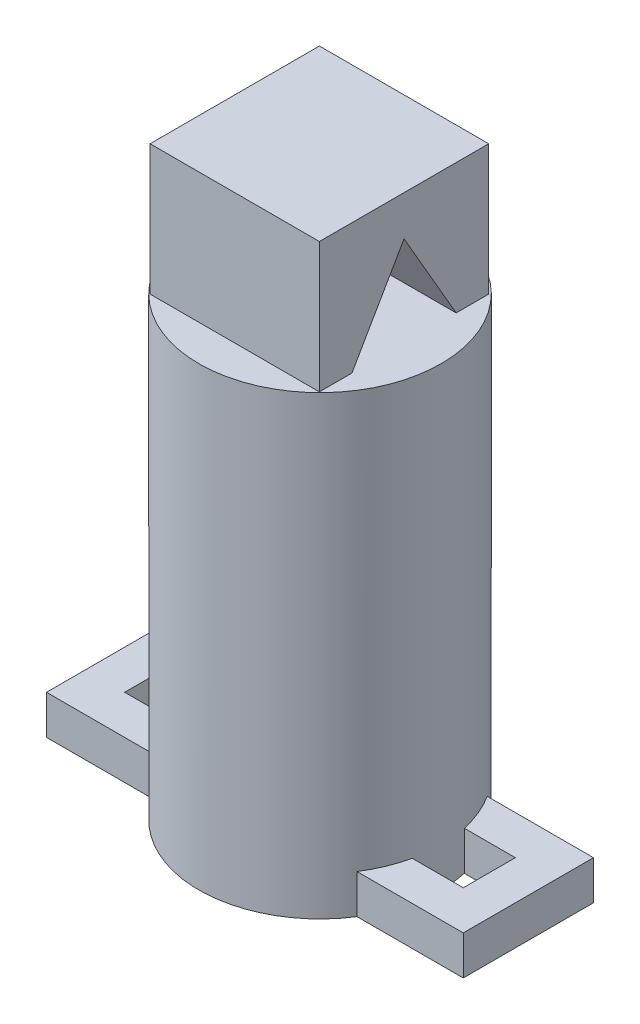
from build123d import *

# Parameters (mm, degrees)
SKETCH1_W               = 13
SKETCH1_H               = 13
BOSS_EXTRUDE1_DEPTH     = 10
SKETCH2_R               = 9.3
BOSS_EXTRUDE2_DEPTH     = 35
SKETCH3_W               = 32
SKETCH3_H               = 10
SKETCH3_W_2             = 7.2
SKETCH3_H_2             = 4
BOSS_EXTRUDE3_DEPTH     = 3
CUT_EXTRUDE1_DEPTH      = 43.634962179
CUT_EXTRUDE1_DEPTH_BACK = 43.634962179


with BuildPart() as part:
    # Sketch1 → Boss-Extrude1 (new body)
    with BuildSketch(Plane(origin=(0, 0, 0), x_dir=(1, 0, 0), z_dir=(0, 1, 0))):
        with Locations((0, -0.046937875)):
            Rectangle(SKETCH1_W, SKETCH1_H)
    extrude(amount=BOSS_EXTRUDE1_DEPTH)

    # Sketch2 → Boss-Extrude2 (add)
    with BuildSketch(Plane.XZ):
        Circle(SKETCH2_R)
    extrude(amount=BOSS_EXTRUDE2_DEPTH)

    # Sketch3 → Boss-Extrude3 (add)
    with BuildSketch(Plane.XZ.offset(35)):
        Rectangle(SKETCH3_W, SKETCH3_H)
        with Locations((-9.4, 0)):
            Rectangle(SKETCH3_W_2, SKETCH3_H_2, mode=Mode.SUBTRACT)
        with Locations((9.4, 0)):
            Rectangle(SKETCH3_W_2, SKETCH3_H_2, mode=Mode.SUBTRACT)
    extrude(amount=-BOSS_EXTRUDE3_DEPTH)

    # Sketch4 → Cut-Extrude1 (cut, two sides: drawn at the far end of the back side and taken through both)
    with BuildSketch(Plane.ZY.offset(6.5).offset(-CUT_EXTRUDE1_DEPTH_BACK)):
        Polygon((-3.953062125, 0), (4.046937875, 0), (0.046937875, 6.92820323), align=None)
    extrude(amount=CUT_EXTRUDE1_DEPTH + CUT_EXTRUDE1_DEPTH_BACK, mode=Mode.SUBTRACT)


solid = part.part
